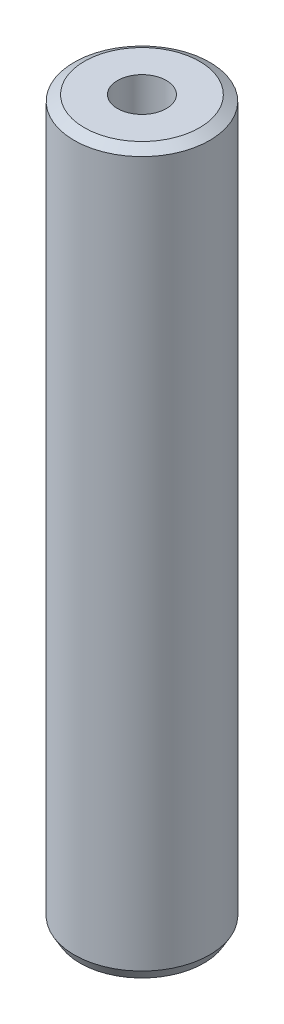
from build123d import *
from OCP.BRepFilletAPI import BRepFilletAPI_MakeChamfer

# Parameters (mm, degrees)
SKETCH1_R           = 40
BOSS_EXTRUDE1_DEPTH = 425.871727261
SKETCH2_R           = 14.408330948
CUT_EXTRUDE1_DEPTH  = 430.612299731
CHAMFER1_SIZE       = 3.470684874
CHAMFER1_SIZE2      = 6.011402538


with BuildPart() as part:
    # Sketch1 → Boss-Extrude1 (new body)
    with BuildSketch(Plane(origin=(0, 0, 0), x_dir=(1, 0, 0), z_dir=(0, 1, 0))):
        Circle(SKETCH1_R)
    extrude(amount=BOSS_EXTRUDE1_DEPTH)

    # Sketch2 → Cut-Extrude1 (cut, through all)
    with BuildSketch(Plane(origin=(0, 0, 0), x_dir=(1, 0, 0), z_dir=(0, 1, 0))):
        Circle(SKETCH2_R)
    extrude(amount=CUT_EXTRUDE1_DEPTH, mode=Mode.SUBTRACT)

    # Chamfer1: one chamfer whose edges measure the first distance from different faces: ONE call of the kernel's chamfer builder (chamfer() names one face for all edges)
    chamfer1_edges_1 = [part.edges().sort_by_distance(p)[0] for p in [
        (-40, 425.871727261, 0),
    ]]
    chamfer1_side_1 = [part.faces().sort_by_distance(p)[0] for p in [
        (-40, 212.93586363, 0),
    ]]
    chamfer1_edges_2 = [part.edges().sort_by_distance(p)[0] for p in [
        (-40, 0, 0),
    ]]
    chamfer1_side_2 = [part.faces().sort_by_distance(p)[0] for p in [
        (-38.86862915, 0, 0),
    ]]
    chamfer1 = BRepFilletAPI_MakeChamfer(part.part.solid().wrapped)
    for e in chamfer1_edges_1:
        chamfer1.Add(CHAMFER1_SIZE, CHAMFER1_SIZE2, e.wrapped, chamfer1_side_1[0].wrapped)  # the first distance lies on this face
    for e in chamfer1_edges_2:
        chamfer1.Add(CHAMFER1_SIZE, CHAMFER1_SIZE2, e.wrapped, chamfer1_side_2[0].wrapped)  # the first distance lies on this face
    add(Compound.cast(chamfer1.Shape()), mode=Mode.REPLACE)


solid = part.part
